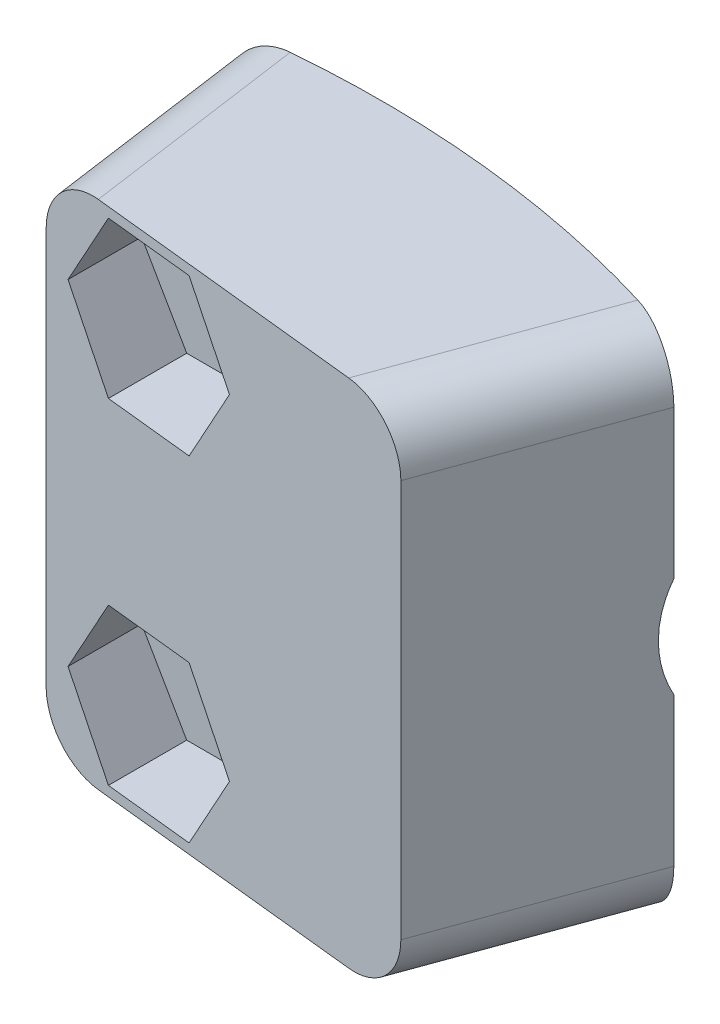
from build123d import *

# Parameters (mm, degrees)
BOSS_EXTRUDE1_DEPTH     = 18
CUT_EXTRUDE1_DEPTH      = 44.04814257
CUT_EXTRUDE1_DEPTH_BACK = 44.04814257
SKETCH5_R               = 1.5
CUT_EXTRUDE2_DEPTH      = 44.048142727
CUT_EXTRUDE3_START      = -18
CUT_EXTRUDE3_DEPTH      = 18
FILLET1_R               = 2
CUT_EXTRUDE4_DEPTH      = 24.246649109
CUT_EXTRUDE4_DEPTH_BACK = 2.5


# Read off the part's stored shape, not the designer's step: Cut-Extrude3
with BuildPart() as part:
    # Sketch2 → Boss-Extrude1 (new body)
    with BuildSketch(Plane(origin=(0, 0, 0), x_dir=(1, 0, 0), z_dir=(0, 1, 0))):
        with BuildLine():
            Line((12.654745303, 34.768626969), (9.918584156, 27.251086003))
            Line((9.918584156, 27.251086003), (-4.036019928, 28.717773994))
            Line((-4.036019928, 28.717773994), (-5.149404736, 36.639918543))
            ThreePointArc((-5.149404736, 36.639918543), (3.867553141, 36.797310129), (12.654745303, 34.768626969))
        make_face()
    extrude(amount=BOSS_EXTRUDE1_DEPTH)

    # Sketch3 → Cut-Extrude1 (cut, two sides: drawn at the far end of the back side and taken through both)
    with BuildSketch(Plane(origin=(0, 0, 0), x_dir=(0, 0, -1), z_dir=(1, 0, 0)).offset(-CUT_EXTRUDE1_DEPTH_BACK)):
        with BuildLine():
            Line((38, 13.1), (39.768626969, 13.1))
            Line((39.768626969, 13.1), (39.768626969, 4.9))
            Line((39.768626969, 4.9), (38, 4.9))
            ThreePointArc((38, 4.9), (33.9, 9), (38, 13.1))
        make_face()
    extrude(amount=CUT_EXTRUDE1_DEPTH + CUT_EXTRUDE1_DEPTH_BACK, mode=Mode.SUBTRACT)

    # Sketch5 → Cut-Extrude2 (cut, through all)
    with BuildSketch(Plane.XY):
        with Locations((0, 3.1)):
            Circle(SKETCH5_R)
        with Locations((0, 14.9)):
            Circle(SKETCH5_R)
    extrude(amount=-CUT_EXTRUDE2_DEPTH, mode=Mode.SUBTRACT)

    # Cut-Extrude3 outline → Cut-Extrude3 (cut)
    with BuildSketch(Plane(origin=(0, 18, 0), x_dir=(1, 0, 0), z_dir=(0, 1, 0)).offset(CUT_EXTRUDE3_START)):
        with BuildLine():
            ThreePointArc((-5.079818185, 36.144784509), (3.815289276, 36.300049142), (12.483735924, 34.298780407))
            Line((12.483735924, 34.298780407), (12.654745303, 34.768626969))
            ThreePointArc((12.654745303, 34.768626969), (3.867553141, 36.797310129), (-5.149404736, 36.639918543))
            Line((-5.149404736, 36.639918543), (-5.079818185, 36.144784509))
        make_face()
    extrude(amount=CUT_EXTRUDE3_DEPTH, mode=Mode.SUBTRACT)

    # Fillet1
    fillet1_edges = [part.edges().sort_by_distance(p)[0] for p in [
        (11.201159694, 18, -30.774933331),
        (11.201159694, 0, -30.774933331),
        (-4.557919056, 0, -32.431279251),
        (-4.557919056, 18, -32.431279251),
    ]]
    fillet(fillet1_edges, radius=FILLET1_R)

    # Sketch7 → Cut-Extrude4 (cut, two sides: drawn at the far end of the back side and taken through both)
    with BuildSketch(Plane.XY.offset(-28.717773994).offset(-CUT_EXTRUDE4_DEPTH_BACK)):
        Polygon((3.175426481, 14.9), (1.58771324, 17.65), (-1.58771324, 17.65), (-3.175426481, 14.9), (-1.58771324, 12.15), (1.58771324, 12.15), align=None)
        Polygon((3.175426481, 3.1), (1.58771324, 5.85), (-1.58771324, 5.85), (-3.175426481, 3.1), (-1.58771324, 0.35), (1.58771324, 0.35), align=None)
    extrude(amount=CUT_EXTRUDE4_DEPTH + CUT_EXTRUDE4_DEPTH_BACK, mode=Mode.SUBTRACT)


solid = part.part
